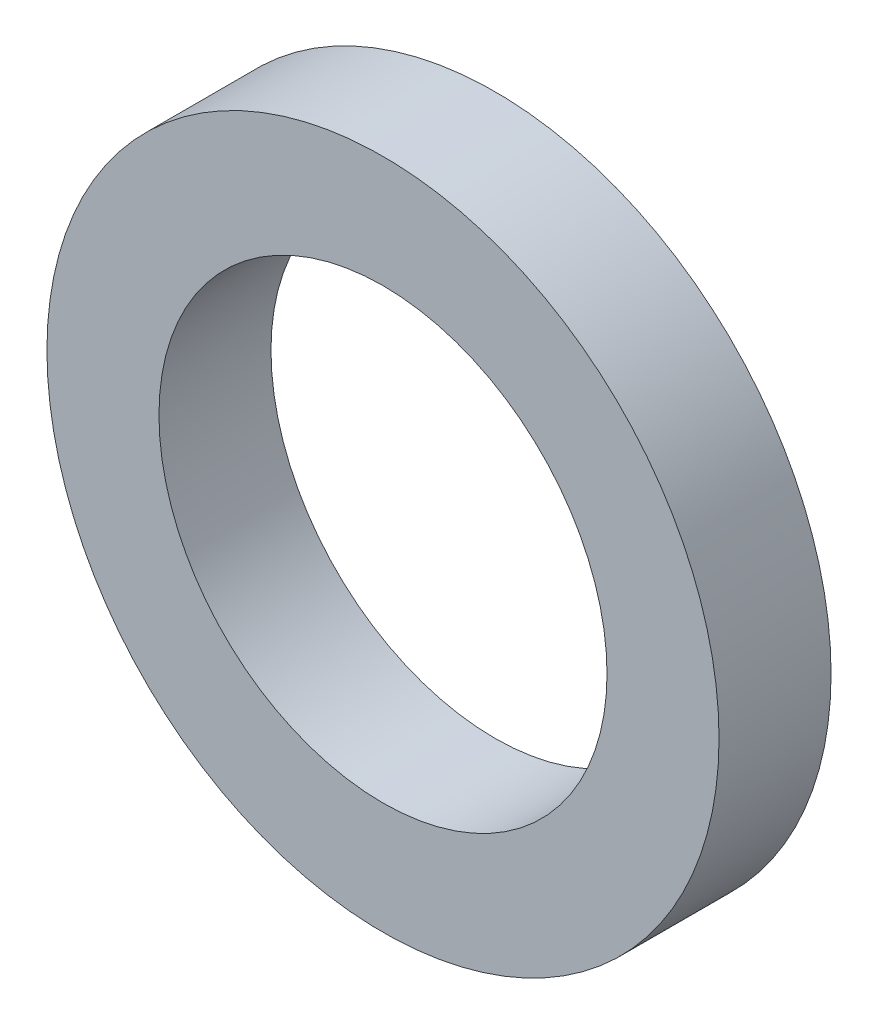
from build123d import *

# Parameters (mm, degrees)
SKETCH1_R           = 14.2875
SKETCH1_R_2         = 9.525
BOSS_EXTRUDE1_DEPTH = 4.7625


with BuildPart() as part:
    # Sketch1 → Boss-Extrude1 (new body)
    with BuildSketch(Plane.XY):
        Circle(SKETCH1_R)
        Circle(SKETCH1_R_2, mode=Mode.SUBTRACT)
    extrude(amount=BOSS_EXTRUDE1_DEPTH)


solid = part.part
